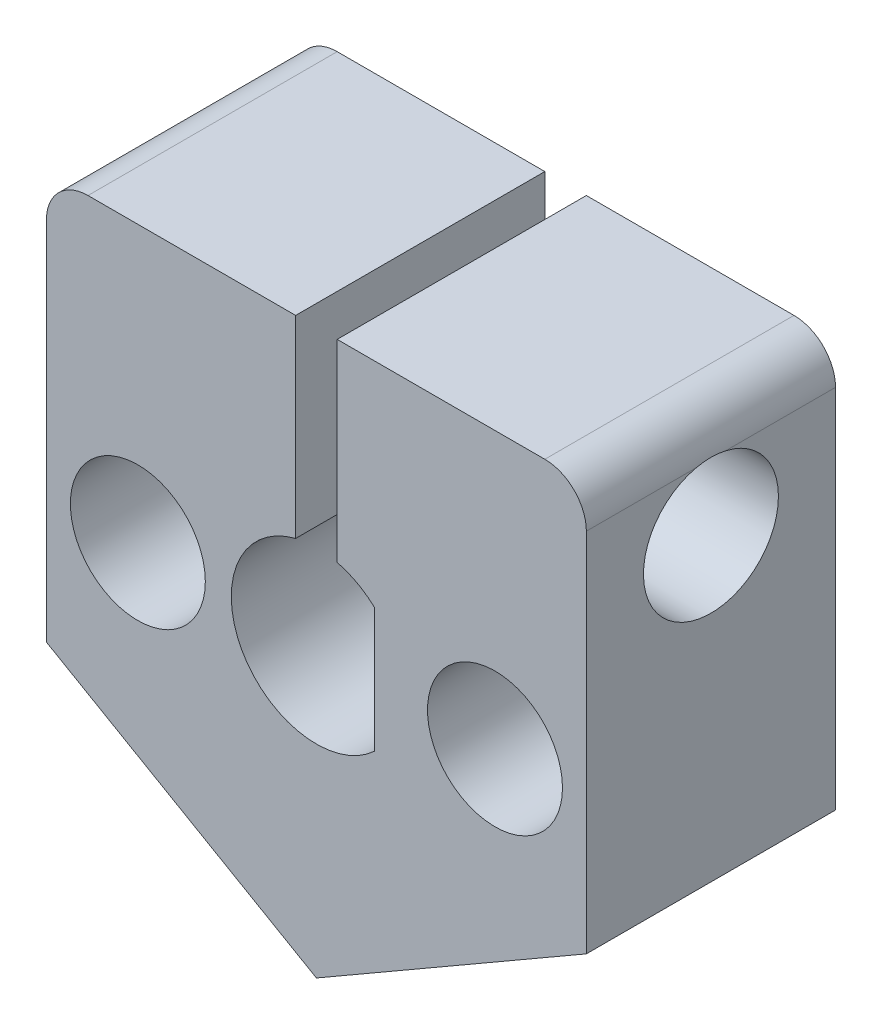
from build123d import *

# Parameters (mm, degrees)
BOSS_EXTRUDE1_DEPTH            = 12
SKETCH41_R                     = 1.71
CUT_EXTRUDE7_DEPTH             = 18
CBORE_FOR_M3_SHCS1_D           = 3.4
CBORE_FOR_M3_SHCS1_CBORE_D     = 6.5
CBORE_FOR_M3_SHCS1_CBORE_DEPTH = 3
CBORE_FOR_M3_SHCS2_D           = 3.4
CBORE_FOR_M3_SHCS2_CBORE_D     = 6.5
CBORE_FOR_M3_SHCS2_CBORE_DEPTH = 3
CUT_EXTRUDE10_DEPTH            = 15
CUT_EXTRUDE10_DEPTH_BACK       = 15
SKETCH52_R                     = 1.7
SKETCH58_R                     = 3.25
CUT_EXTRUDE11_DEPTH            = 8
CUT_EXTRUDE12_DEPTH            = 4
CUT_EXTRUDE12_DEPTH_BACK       = 6
FILLET1_R                      = 2
SKETCH61_R                     = 3.25
CUT_EXTRUDE13_DEPTH            = 6
CUT_EXTRUDE14_DEPTH            = 1


with BuildPart() as part:
    # Sketch1 → Boss-Extrude1 (new body)
    with BuildSketch(Plane(origin=(0, 0, 0), x_dir=(0, 1, 0), z_dir=(0, 0, 1))):
        with BuildLine():
            Line((-6.350852961, -13), (13.279056191, -13))
            Line((13.279056191, -13), (13.279056191, -1))
            Line((13.279056191, -1), (3.97617907, -1))
            ThreePointArc((3.97617907, -1), (3.601659304, -1.959094244), (3, -2.794637722))
            Line((3, -2.794637722), (-3, -2.794637722))
            ThreePointArc((-3, -2.794637722), (-3.815101571, -1.501665742), (-4.1, 0))
            ThreePointArc((-4.1, 0), (-0.503818326, 4.06892702), (3.97617907, 1))
            Line((3.97617907, 1), (13.279056191, 1))
            Line((13.279056191, 1), (13.279056191, 13))
            Line((13.279056191, 13), (-6.350852961, 13))
            Line((-6.350852961, 13), (-13.856406461, 0))
            Line((-13.856406461, 0), (-6.350852961, -13))
        make_face()
    extrude(amount=BOSS_EXTRUDE1_DEPTH)

    # Sketch41 → Cut-Extrude7 (cut)
    with BuildSketch(Plane(origin=(0, 0, 0), x_dir=(0, 1, 0), z_dir=(0, 0, 1))):
        with Locations(Location((0, 8.6, 0), (0, 0, 270))):
            Circle(SKETCH41_R)
        with Locations(Location((0, -8.6, 0), (0, 0, 270))):
            Circle(SKETCH41_R)
    extrude(amount=CUT_EXTRUDE7_DEPTH, mode=Mode.SUBTRACT)

    # CBORE for M3 SHCS1 (through all)
    with Locations(Plane(origin=(-8.6, 0, 12), x_dir=(1, 0, 0), z_dir=(0, 0, 1))):
        with Locations((0, 0)):
            CounterBoreHole(CBORE_FOR_M3_SHCS1_D / 2, CBORE_FOR_M3_SHCS1_CBORE_D / 2, CBORE_FOR_M3_SHCS1_CBORE_DEPTH)

    # CBORE for M3 SHCS2 (through all)
    with Locations(Plane(origin=(8.6, 0, 12), x_dir=(1, 0, 0), z_dir=(0, 0, 1))):
        with Locations((0, 0)):
            CounterBoreHole(CBORE_FOR_M3_SHCS2_D / 2, CBORE_FOR_M3_SHCS2_CBORE_D / 2, CBORE_FOR_M3_SHCS2_CBORE_DEPTH)

    # Sketch52 → Cut-Extrude10 (cut, two sides: drawn at the far end of the back side and taken through both)
    with BuildSketch(Plane.YZ.offset(-1).offset(-CUT_EXTRUDE10_DEPTH_BACK)):
        with Locations((8.106406461, 6)):
            Circle(SKETCH52_R)
    extrude(amount=CUT_EXTRUDE10_DEPTH + CUT_EXTRUDE10_DEPTH_BACK, mode=Mode.SUBTRACT)

    # Sketch58 → Cut-Extrude11 (cut)
    with BuildSketch(Plane.YZ.offset(13)):
        with Locations(Location((8.106406461, 6, 0), (0, 0, 270))):
            Circle(SKETCH58_R)
    extrude(amount=-CUT_EXTRUDE11_DEPTH, mode=Mode.SUBTRACT)

    # Sketch60 → Cut-Extrude12 (cut, two sides: drawn at the far end of the back side and taken through both)
    with BuildSketch(Plane.YZ.offset(-8).offset(-CUT_EXTRUDE12_DEPTH_BACK)):
        Polygon((8.106406461, 2.709103466), (10.956406461, 4.354551733), (10.956406461, 7.645448267), (8.106406461, 9.290896534), (5.256406461, 7.645448267), (5.256406461, 4.354551733), align=None)
    extrude(amount=CUT_EXTRUDE12_DEPTH + CUT_EXTRUDE12_DEPTH_BACK, mode=Mode.SUBTRACT)

    # Fillet1
    # the kernel refuses this fillet: 2 mm, written as the material it takes off along each edge
    with BuildSketch(Plane(origin=(13, 13.279056191, -5), x_dir=(0, -1, 0), z_dir=(0, 0, 1))) as fillet1_piece_1:
        with BuildLine():
            CenterArc((FILLET1_R, -FILLET1_R), FILLET1_R, 90, 90)
            Line((0, -FILLET1_R), (0, 0))
            Line((0, 0), (FILLET1_R, 0))
        make_face()
    extrude(amount=22, mode=Mode.SUBTRACT)
    with BuildSketch(Plane(origin=(-13, 13.279056191, -5), x_dir=(0, -1, 0), z_dir=(0, 0, 1))) as fillet1_piece_2:
        with BuildLine():
            CenterArc((FILLET1_R, FILLET1_R), FILLET1_R, 180, 90)
            Line((0, FILLET1_R), (0, 0))
            Line((0, 0), (FILLET1_R, 0))
        make_face()
    extrude(amount=22, mode=Mode.SUBTRACT)

    # Sketch61 → Cut-Extrude13 (cut)
    with BuildSketch(Plane(origin=(0, 0, 12), x_dir=(0, 1, 0), z_dir=(0, 0, 1))):
        with Locations(Location((0, 8.6, 0), (0, 0, 270))):
            Circle(SKETCH61_R)
        with Locations(Location((0, -8.6, 0), (0, 0, 270))):
            Circle(SKETCH61_R)
    extrude(amount=-CUT_EXTRUDE13_DEPTH, mode=Mode.SUBTRACT)

    # Sketch62 → Cut-Extrude14 (cut)
    with BuildSketch(Plane(origin=(-6, -10.392304845, 0), x_dir=(0.8660254037844386, -0.5000000000000001, 0), z_dir=(-0.5000000000000001, -0.8660254037844386, 0))):
        with BuildLine():
            Line((1.681473513, 6.646959362), (1.681473513, 6.287985003))
            Line((1.681473513, 6.287985003), (0.491669827, 6.287985003))
            Line((0.491669827, 6.287985003), (0.302366943, 5.367412086))
            add(Edge.make_bspline(
                [(0.302366943, 5.367412086), (0.339422817, 5.377642358), (0.411212713, 5.397461892), (0.517172574, 5.419467662), (0.617764777, 5.432733106), (0.683040148, 5.434544417), (0.714626558, 5.435420901)],
                knots=[0, 0, 0, 0, 1.100273476, 2.13160584, 3.095893838, 4, 4, 4, 4], degree=3))
            add(Edge.make_bspline(
                [(0.714626558, 5.435420901), (0.753710298, 5.434574965), (0.830558695, 5.432911644), (0.942997642, 5.416939795), (1.050330535, 5.39179988), (1.152332906, 5.356679358), (1.249193456, 5.311769625), (1.340021018, 5.255669685), (1.426178931, 5.190136353), (1.506121525, 5.114791341), (1.578645833, 5.031869725), (1.642411822, 4.942711854), (1.696574413, 4.848184192), (1.740135168, 4.747383583), (1.774919502, 4.641424429), (1.798071497, 4.529191847), (1.813488206, 4.411743727), (1.815210592, 4.331439157), (1.816088898, 4.29048901)],
                knots=[0, 0, 0, 0, 1.052922333, 2.070308379, 3.05430497, 4.020497103, 4.973039431, 5.925935799, 6.892292201, 7.88610001, 8.88166317, 9.857072816, 10.836096531, 11.812156883, 12.81219415, 13.836441305, 14.89672472, 16, 16, 16, 16], degree=3))
            add(Edge.make_bspline(
                [(1.816088898, 4.29048901), (1.815423823, 4.261966789), (1.81410266, 4.205307802), (1.807384072, 4.121163601), (1.794448356, 4.038800768), (1.777080632, 3.958208376), (1.754538214, 3.879539004), (1.72724916, 3.802567476), (1.693853133, 3.727772869), (1.657221758, 3.654447474), (1.61597528, 3.584248967), (1.570196772, 3.51859998), (1.521831281, 3.456515699), (1.469789896, 3.398661966), (1.4135889, 3.345418948), (1.353908934, 3.296470667), (1.291226215, 3.250989336), (1.224570972, 3.210821141), (1.155428489, 3.173858185), (1.082800272, 3.143534648), (1.008339572, 3.116424119), (0.930974696, 3.094814592), (0.850880883, 3.077882037), (0.767926108, 3.066381437), (0.682545438, 3.058004999), (0.624670425, 3.057480642), (0.595435853, 3.057215772)],
                knots=[0, 0, 0, 0, 1.056347294, 2.098418968, 3.122841568, 4.141288669, 5.149314143, 6.15115421, 7.162517403, 8.180376062, 9.185164535, 10.17417709, 11.141909838, 12.097768115, 13.052685741, 14.0056014, 14.954263652, 15.917497458, 16.885230207, 17.854509472, 18.828990115, 19.81800267, 20.826176721, 21.857883937, 22.917946725, 24, 24, 24, 24], degree=3))
            add(Edge.make_bspline(
                [(0.595435853, 3.057215772), (0.560561672, 3.05790661), (0.491950842, 3.059265752), (0.391430275, 3.073484238), (0.294715669, 3.093848154), (0.202585568, 3.124484424), (0.114214304, 3.162871719), (0.030791586, 3.21138789), (-0.04981419, 3.266366994), (-0.124326227, 3.331247347), (-0.19348234, 3.402163029), (-0.255388849, 3.47912067), (-0.310522426, 3.560850112), (-0.358000173, 3.647748266), (-0.398498194, 3.739586797), (-0.430313182, 3.836709798), (-0.455991537, 3.938609802), (-0.466854958, 4.008763312), (-0.472372641, 4.04439526)],
                knots=[0, 0, 0, 0, 1.0467383, 2.05933395, 3.04377827, 4.011590433, 4.970194871, 5.932262533, 6.905835911, 7.896367577, 8.894135286, 9.877477877, 10.858688626, 11.851381753, 12.8477658, 13.868841284, 14.917554742, 16, 16, 16, 16], degree=3))
            Line((-0.472372641, 4.04439526), (-0.158270076, 4.04439526))
            add(Edge.make_bspline(
                [(-0.158270076, 4.04439526), (-0.150541519, 4.011018807), (-0.135686803, 3.946867412), (-0.103081054, 3.856736071), (-0.063215178, 3.776416847), (-0.01581083, 3.704847264), (0.040739201, 3.642438267), (0.105268629, 3.586821205), (0.177616353, 3.536646075), (0.258009582, 3.494823308), (0.342822662, 3.459154555), (0.431589872, 3.43540286), (0.521894218, 3.418701967), (0.582972588, 3.417030206), (0.61366502, 3.416190131)],
                knots=[0, 0, 0, 0, 1.136247022, 2.183929868, 3.172523383, 4.106158343, 5.02341133, 5.958108904, 6.928429099, 7.938127109, 8.96079061, 9.975095812, 10.982467395, 12, 12, 12, 12], degree=3))
            add(Edge.make_bspline(
                [(0.61366502, 3.416190131), (0.643623464, 3.417010909), (0.702611886, 3.418627028), (0.789423273, 3.43106604), (0.873236147, 3.450223611), (0.953223504, 3.478893466), (1.030785044, 3.513738184), (1.103958814, 3.55845326), (1.174861691, 3.609913279), (1.241289825, 3.668869909), (1.302129274, 3.733839603), (1.355885395, 3.803316997), (1.400662308, 3.877433843), (1.438396417, 3.954906996), (1.467049716, 4.036585553), (1.487490697, 4.122086729), (1.499493756, 4.211621709), (1.501144936, 4.272691019), (1.501986334, 4.303810324)],
                knots=[0, 0, 0, 0, 1.027316725, 2.022795036, 3.002884548, 3.971462791, 4.93288096, 5.914575861, 6.907176829, 7.935150275, 8.956128384, 9.956726525, 10.942570165, 11.921478529, 12.907843606, 13.90538589, 14.932640048, 16, 16, 16, 16], degree=3))
            add(Edge.make_bspline(
                [(1.501986334, 4.303810324), (1.501327854, 4.331886075), (1.500038975, 4.386840364), (1.489508404, 4.467239571), (1.471191432, 4.543312613), (1.445767552, 4.615426847), (1.413488044, 4.683650289), (1.374041732, 4.74805335), (1.326688334, 4.807787183), (1.272596445, 4.862879736), (1.213338404, 4.913724611), (1.147894662, 4.957068698), (1.077634735, 4.993532615), (1.003405136, 5.025000614), (0.923440237, 5.047601359), (0.839323605, 5.064569245), (0.750146897, 5.074384607), (0.689176208, 5.075746496), (0.657835693, 5.076446542)],
                knots=[0, 0, 0, 0, 1.045622112, 2.046656509, 3.013763289, 3.955457236, 4.890082067, 5.820317437, 6.762574623, 7.722996705, 8.69280354, 9.665887285, 10.63943826, 11.638615906, 12.663482002, 13.728887084, 14.832589034, 16, 16, 16, 16], degree=3))
            add(Edge.make_bspline(
                [(0.657835693, 5.076446542), (0.630706764, 5.07586595), (0.574692409, 5.074667177), (0.488769582, 5.06584068), (0.398477859, 5.051601386), (0.304163363, 5.032015138), (0.205542855, 5.006384062), (0.102824455, 4.975669561), (-0.004207812, 4.938947562), (-0.076325536, 4.911215348), (-0.113398282, 4.896959362)],
                knots=[0, 0, 0, 0, 0.817624296, 1.688186739, 2.600797293, 3.572016777, 4.590301741, 5.671205678, 6.80286297, 8, 8, 8, 8], degree=3))
            Line((-0.113398282, 4.896959362), (0.245576077, 6.646959362))
            Line((0.245576077, 6.646959362), (1.681473513, 6.646959362))
        make_face()
    extrude(amount=-CUT_EXTRUDE14_DEPTH, mode=Mode.SUBTRACT)


solid = part.part
